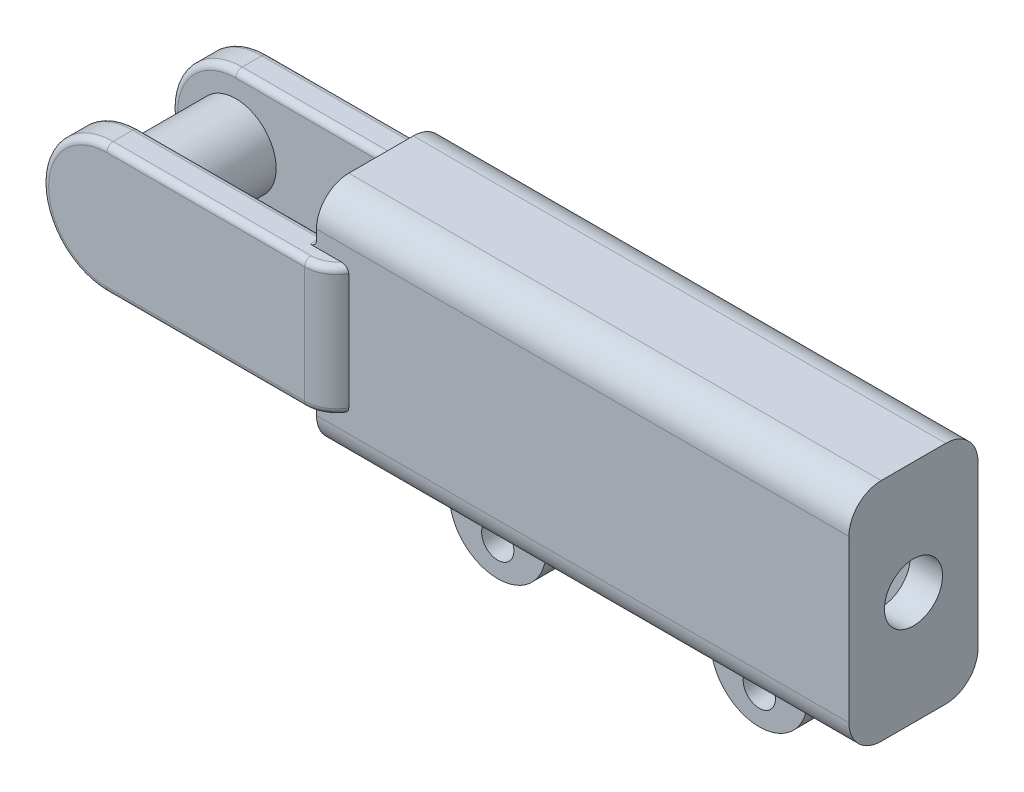
from build123d import *

# Parameters (mm, degrees)
BOSS_EXTRUDE1_DEPTH      = 25
BOSS_EXTRUDE1_DEPTH_BACK = 25
SKETCH2_W                = 30
SKETCH2_H                = 40
CUT_EXTRUDE1_DEPTH       = 96.524865873
BOSS_EXTRUDE2_REACH      = 90.318
SKETCH3_R                = 12.5
STRUCTURAL_MEMBER1_DEPTH = 150
BOSS_EXTRUDE3_DEPTH      = 10
BOSS_EXTRUDE4_DEPTH      = 5
BOSS_EXTRUDE4_DEPTH_BACK = 5
FILLET1_R                = 10
FILLET2_R                = 2
FILLET3_R                = 2
SKETCH17_W               = 30
SKETCH17_H               = 10
BOSS_EXTRUDE5_DEPTH      = 20
BOSS_EXTRUDE5_2_DEPTH    = 20
FILLET4_R                = 15
SKETCH18_R               = 5
CUT_EXTRUDE2_DEPTH       = 10
FILLET5_R                = 15
SKETCH19_R               = 5
CUT_EXTRUDE3_DEPTH       = 10
SKETCH20_R               = 9
CUT_EXTRUDE4_DEPTH       = 20


# Some blends are built 0.0001 mm under size
with BuildPart() as part:
    # Sketch1 → Boss-Extrude1 (new, two sides: drawn at the far end of the back side and taken through both)
    with BuildSketch(Plane.XY.offset(-BOSS_EXTRUDE1_DEPTH_BACK)):
        with BuildLine():
            Line((0, 20), (70, 20))
            Line((70, 20), (70, -20))
            Line((70, -20), (0, -20))
            ThreePointArc((0, -20), (-20, 0), (0, 20))
        make_face()
    extrude(amount=BOSS_EXTRUDE1_DEPTH + BOSS_EXTRUDE1_DEPTH_BACK)

    # Sketch2 → Cut-Extrude1 (cut, through all)
    with BuildSketch(Plane(origin=(70, 0, 0), x_dir=(0, 0, -1), z_dir=(1, 0, 0))):
        Rectangle(SKETCH2_W, SKETCH2_H)
    extrude(amount=-CUT_EXTRUDE1_DEPTH, mode=Mode.SUBTRACT)


with BuildPart() as cut_extrude1_piece_1:
    # of the separate pieces the step leaves, piece 1, a body of its own (cut_extrude1_pieces)
    add(part.part.solids().sort_by_distance((0, 20, -25))[0])

    # Sketch3 → Boss-Extrude2 (add, up to next)
    with BuildSketch(Plane.XY.offset(25), mode=Mode.PRIVATE) as boss_extrude2_sk1:
        Circle(SKETCH3_R)
    boss_extrude2_tool1 = extrude(boss_extrude2_sk1.sketch, amount=-BOSS_EXTRUDE2_REACH, mode=Mode.PRIVATE) - cut_extrude1_piece_1.part


with BuildPart() as cut_extrude1_piece_2:
    # of the separate pieces the step leaves, piece 2, a body of its own (cut_extrude1_pieces)
    add(part.part.solids().sort_by_distance((0, 20, 15))[0])


with BuildPart() as cut_extrude1_piece_1_1:
    add(cut_extrude1_piece_1.part)

    add(cut_extrude1_piece_2.part)  # Boss-Extrude2 merges Cut-Extrude1 piece 2
    add(boss_extrude2_tool1.solids().sort_by_distance((0, 0, 25))[0])



with BuildPart() as body_2:
    # Sketch11 → Structural Member1 (new body)
    with BuildSketch(Plane(origin=(70, 0, 0), x_dir=(0, 0, 1), z_dir=(1, 0, 0))):
        with BuildLine():
            Line((-10, -35), (10, -35))
            ThreePointArc((10, -35), (17.071067812, -32.071067812), (20, -25))
            Line((20, -25), (20, 25))
            ThreePointArc((20, 25), (17.071067812, 32.071067812), (10, 35))
            Line((10, 35), (-10, 35))
            ThreePointArc((-10, 35), (-17.071067812, 32.071067812), (-20, 25))
            Line((-20, 25), (-20, -25))
            ThreePointArc((-20, -25), (-17.071067812, -32.071067812), (-10, -35))
        make_face()
        with BuildLine():
            Line((-10, -30), (10, -30))
            ThreePointArc((10, -30), (13.535533906, -28.535533906), (15, -25))
            Line((15, -25), (15, 25))
            ThreePointArc((15, 25), (13.535533906, 28.535533906), (10, 30))
            Line((10, 30), (-10, 30))
            ThreePointArc((-10, 30), (-13.535533906, 28.535533906), (-15, 25))
            Line((-15, 25), (-15, -25))
            ThreePointArc((-15, -25), (-13.535533906, -28.535533906), (-10, -30))
        make_face(mode=Mode.SUBTRACT)
    extrude(amount=STRUCTURAL_MEMBER1_DEPTH)


with BuildPart() as cut_extrude1_piece_1_2:
    add(cut_extrude1_piece_1_1.part)

    add(body_2.part)  # Boss-Extrude3 merges body 2
    # Sketch12 → Boss-Extrude3 (add)
    with BuildSketch(Plane.ZY.offset(-70)):
        with BuildLine():
            Line((20, -25), (20, 25))
            ThreePointArc((20, 25), (17.071067812, 32.071067812), (10, 35))
            Line((10, 35), (-10, 35))
            ThreePointArc((-10, 35), (-17.071067812, 32.071067812), (-20, 25))
            Line((-20, 25), (-20, -25))
            ThreePointArc((-20, -25), (-17.071067812, -32.071067812), (-10, -35))
            Line((-10, -35), (10, -35))
            ThreePointArc((10, -35), (17.071067812, -32.071067812), (20, -25))
        make_face()
    extrude(amount=BOSS_EXTRUDE3_DEPTH)

    # Sketch14 → Boss-Extrude4 (add, two sides: drawn at the far end of the back side and taken through both)
    with BuildSketch(Plane(origin=(220, 0, 0), x_dir=(0, 0, -1), z_dir=(1, 0, 0)).offset(-BOSS_EXTRUDE4_DEPTH_BACK)):
        with BuildLine():
            Line((10, 35), (-10, 35))
            ThreePointArc((-10, 35), (-17.071067812, 32.071067812), (-20, 25))
            Line((-20, 25), (-20, -25))
            ThreePointArc((-20, -25), (-17.071067812, -32.071067812), (-10, -35))
            Line((-10, -35), (10, -35))
            ThreePointArc((10, -35), (17.071067812, -32.071067812), (20, -25))
            Line((20, -25), (20, 25))
            ThreePointArc((20, 25), (17.071067812, 32.071067812), (10, 35))
        make_face()
    extrude(amount=BOSS_EXTRUDE4_DEPTH + BOSS_EXTRUDE4_DEPTH_BACK)

    # Fillet1
    # the kernel refuses this fillet: 10 mm, written as the material it takes off along each edge
    with BuildSketch(Plane(origin=(70, 41.650635095, -25), x_dir=(-1, 0, 0), z_dir=(0, -1, 0))) as fillet1_piece_1:
        with BuildLine():
            CenterArc((8.660254038, -10), FILLET1_R, 90, 60)
            Line((0, -5), (-0.173205081, -4.9))
            ThreePointArc((-0.173205081, -4.9), (-0.2, -2.5), (-0.2, 0))
            Line((-0.2, 0), (0, 0.2))
            Line((0, 0.2), (8.660254038, 0.2))
            Line((8.660254038, 0.2), (8.660254038, 0))
        make_face()
    extrude(amount=83.301270189, mode=Mode.SUBTRACT)
    with BuildSketch(Plane(origin=(70, 41.650635095, 25), x_dir=(-1, 0, 0), z_dir=(0, -1, 0))) as fillet1_piece_2:
        with BuildLine():
            CenterArc((8.660254038, 10), FILLET1_R, 210, 60)
            Line((0, 5), (-0.173205081, 4.9))
            ThreePointArc((-0.173205081, 4.9), (-0.2, 2.5), (-0.2, 0))
            Line((-0.2, 0), (0, -0.2))
            Line((0, -0.2), (8.660254038, -0.2))
            Line((8.660254038, -0.2), (8.660254038, 0))
        make_face()
    extrude(amount=83.301270189, mode=Mode.SUBTRACT)

    # Fillet2
    fillet2_edges = [cut_extrude1_piece_1_2.edges().sort_by_distance(p)[0] for p in [
        (-12.5, 0, 15),
        (30, 20, -15),
        (-20, 0, -15),
        (30, -20, -15),
        (-20, 0, 15),
        (30, 20, 15),
        (60, 0, -15),
        (30, -20, 15),
        (60, 0, 15),
        (60, 20, 17.5),
        (60, 20, -17.5),
        (60, -20, -17.5),
        (60, -20, 17.5),
    ]]
    fillet(fillet2_edges, radius=FILLET2_R)

    # Fillet3
    fillet3_edges = [cut_extrude1_piece_1_2.edges().sort_by_distance(p)[0] for p in [
        (66.339745962, 20, 23.660254038),
        (30.669872981, 20, 25),
        (-20, 0, 25),
        (66.339745962, -20, 23.660254038),
        (66.339745962, 20, -23.660254038),
        (30.669872981, 20, -25),
        (-20, 0, -25),
        (66.339745962, -20, -23.660254038),
        (30.669872981, -20, 25),
        (30.669872981, -20, -25),
    ]]
    fillet(fillet3_edges, radius=FILLET3_R)

    # Sketch20 → Cut-Extrude4 (cut)
    with BuildSketch(Plane(origin=(225, 0, 0), x_dir=(0, 0, -1), z_dir=(1, 0, 0))):
        Circle(SKETCH20_R)
    extrude(amount=-CUT_EXTRUDE4_DEPTH, mode=Mode.SUBTRACT)


with BuildPart() as body_2_2:
    # Sketch17 → Boss-Extrude5 (new body)
    with BuildSketch(Plane.XZ.offset(35)):
        with Locations((101.952035875, 0.779833619)):
            Rectangle(SKETCH17_W, SKETCH17_H)
    extrude(amount=BOSS_EXTRUDE5_DEPTH)

    # Fillet4
    fillet4_edges = [body_2_2.edges().sort_by_distance(p)[0] for p in [
        (116.952035875, -55, 0.779833619),
        (86.952035875, -55, 0.779833619),
    ]]
    fillet(fillet4_edges, radius=FILLET4_R - 0.0001)  # a hair under: the kernel refuses the full size

    # Sketch19 → Cut-Extrude3 (cut)
    with BuildSketch(Plane.XY.offset(5.779833619)):
        with Locations((101.952035875, -45)):
            Circle(SKETCH19_R)
    extrude(amount=-CUT_EXTRUDE3_DEPTH, mode=Mode.SUBTRACT)


with BuildPart() as body_3:
    # Sketch17 → Boss-Extrude5 2 (new body)
    with BuildSketch(Plane.XZ.offset(35)):
        with Locations((182.217277183, 0)):
            Rectangle(SKETCH17_W, SKETCH17_H)
    extrude(amount=BOSS_EXTRUDE5_2_DEPTH)

    # Sketch18 → Cut-Extrude2 (cut)
    with BuildSketch(Plane(origin=(0, 0, -5), x_dir=(-1, 0, 0), z_dir=(0, 0, -1))):
        with Locations(Location((-182.217277183, -45, 0), (0, 0, 90))):
            Circle(SKETCH18_R)
    extrude(amount=-CUT_EXTRUDE2_DEPTH, mode=Mode.SUBTRACT)

    # Fillet5
    fillet5_edges = [body_3.edges().sort_by_distance(p)[0] for p in [
        (197.217277183, -55, 0),
        (167.217277183, -55, 0),
    ]]
    fillet(fillet5_edges, radius=FILLET5_R - 0.0001)  # a hair under: the kernel refuses the full size


solid = Compound([cut_extrude1_piece_1_2.part, body_2_2.part, body_3.part])
